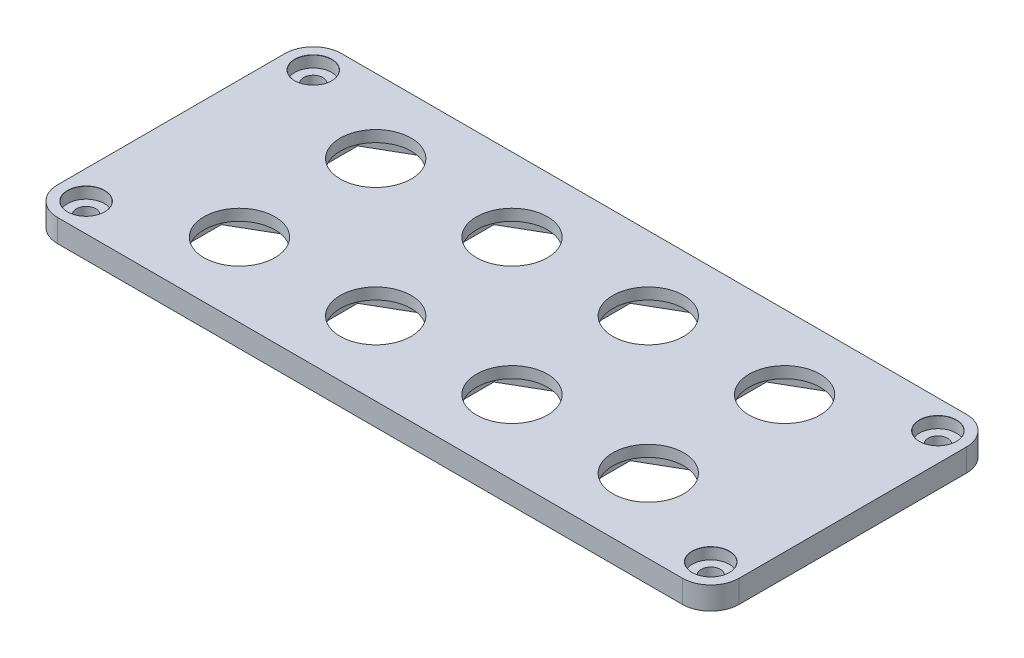
from build123d import *

# Parameters (mm, degrees)
SKETCH1_W               = 120
SKETCH1_H               = 50
BODY_DEPTH              = 4
EDGE_FILLETS_R          = 5
GX12_HOLE_D             = 12.5
GX12_NUT_CUT_DEPTH      = 2
GX12_PATTERN_COUNT      = 4
GX12_PATTERN_PITCH      = 24
GX12_PATTERN_COUNT_DIR2 = 2
GX12_PATTERN_PITCH_DIR2 = 24


# Read off the part's stored shape, not the designer's step: mounting_holes
with BuildPart() as part:
    # Sketch1 → body (new body)
    with BuildSketch(Plane(origin=(0, 0, 0), x_dir=(1, 0, 0), z_dir=(0, 1, 0))):
        Rectangle(SKETCH1_W, SKETCH1_H)
    extrude(amount=BODY_DEPTH)

    # mounting_holes outline → mounting_holes (revolve, cut)
    with BuildSketch(Plane(origin=(55, 0, 20), x_dir=(1, 0, 0), z_dir=(0, 0, 1))):
        Polygon((0, 0), (1.7, 0), (1.7, 2), (3.25, 2), (3.25, 3.975), (3.275, 4), (0, 4), align=None)
    revolve(axis=Axis((55, 0, 20), (0, 1, 0)), mode=Mode.SUBTRACT)

    # mounting_holes 2 outline → mounting_holes 2 (revolve, cut)
    with BuildSketch(Plane(origin=(-55, 0, -20), x_dir=(1, 0, 0), z_dir=(0, 0, 1))):
        Polygon((0, 4), (0, 0), (1.7, 0), (1.7, 2), (3.25, 2), (3.25, 3.975), (3.275, 4), align=None)
    revolve(axis=Axis((-55, 0, -20), (0, 1, 0)), mode=Mode.SUBTRACT)

    # mounting_holes 3 outline → mounting_holes 3 (revolve, cut)
    with BuildSketch(Plane(origin=(55, 0, -20), x_dir=(1, 0, 0), z_dir=(0, 0, 1))):
        Polygon((0, 4), (0, 0), (1.7, 0), (1.7, 2), (3.25, 2), (3.25, 3.975), (3.275, 4), align=None)
    revolve(axis=Axis((55, 0, -20), (0, 1, 0)), mode=Mode.SUBTRACT)

    # mounting_holes 4 outline → mounting_holes 4 (revolve, cut)
    with BuildSketch(Plane(origin=(-55, 0, 20), x_dir=(1, 0, 0), z_dir=(0, 0, 1))):
        Polygon((0, 4), (0, 0), (1.7, 0), (1.7, 2), (3.25, 2), (3.25, 3.975), (3.275, 4), align=None)
    revolve(axis=Axis((-55, 0, 20), (0, 1, 0)), mode=Mode.SUBTRACT)

    # edge_fillets
    edge_fillets_edges = [part.edges().sort_by_distance(p)[0] for p in [
        (60, 2, 25),
        (-60, 2, 25),
        (-60, 2, -25),
        (60, 2, -25),
    ]]
    fillet(edge_fillets_edges, radius=EDGE_FILLETS_R)

    # gx12_hole (through all)
    with Locations(Plane(origin=(0, 4, 0), x_dir=(1, 0, 0), z_dir=(0, 1, 0))):
        with Locations((-36, 12)):
            gx12_hole = Hole(GX12_HOLE_D / 2)

    # Sketch6 → gx12_nut_cut (cut)
    with BuildSketch(Plane.XZ):
        Polygon((-36, -3.339745962), (-43.5, -7.669872981), (-43.5, -16.330127019), (-36, -20.660254038), (-28.5, -16.330127019), (-28.5, -7.669872981), align=None)
    gx12_nut_cut = extrude(amount=-GX12_NUT_CUT_DEPTH, mode=Mode.SUBTRACT)

    # gx12_pattern: gx12_hole, gx12_nut_cut 4 × 2
    with Locations(*[(i * GX12_PATTERN_PITCH, 0, j * GX12_PATTERN_PITCH_DIR2) for i in range(GX12_PATTERN_COUNT) for j in range(GX12_PATTERN_COUNT_DIR2) if (i, j) != (0, 0)]):
        add(gx12_hole, mode=Mode.SUBTRACT)
        add(gx12_nut_cut, mode=Mode.SUBTRACT)


solid = part.part
